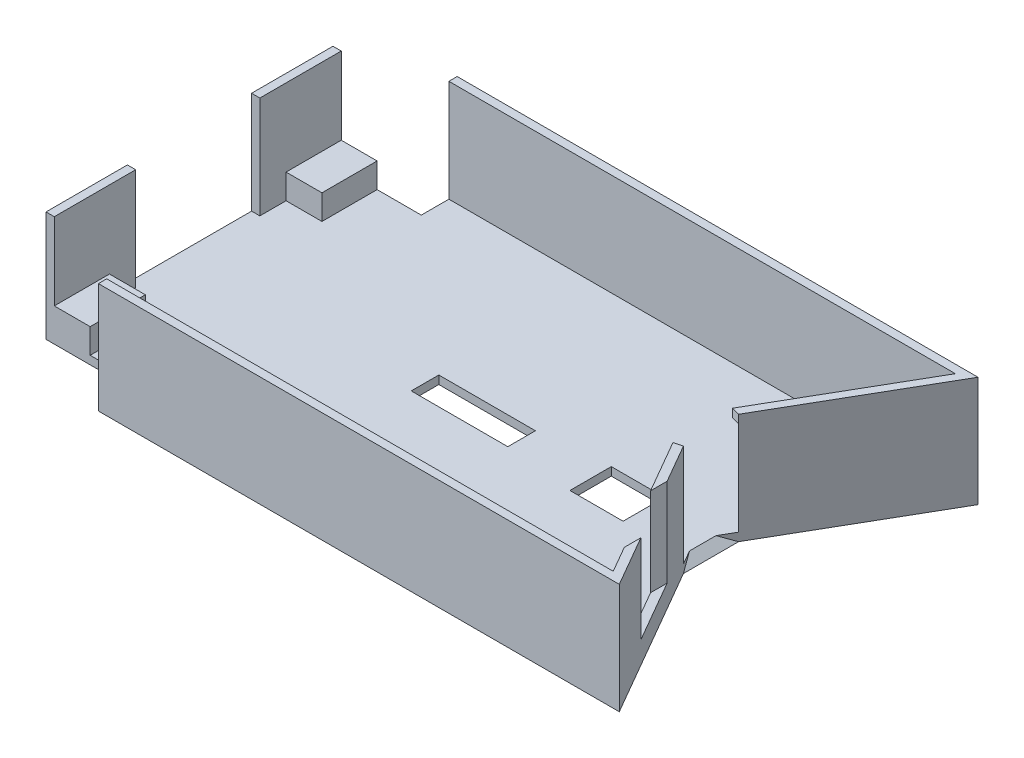
from build123d import *

# Parameters (mm, degrees)
BOSS_EXTRUDE1_DEPTH = 40
SHELL5_START        = 3
SHELL5_DEPTH        = 34
CHAMFER1_SIZE       = 3
CUT_EXTRUDE1_DEPTH  = 3
SKETCH7_W           = 13
SKETCH7_H           = 9
CUT_EXTRUDE3_DEPTH  = 10
SKETCH7_4_W         = 13
SKETCH7_4_H         = 9
BOSS_EXTRUDE7_DEPTH = 30
CUT_EXTRUDE8_DEPTH  = 55
SKETCH7_6_W         = 13
SKETCH7_6_H         = 9
CUT_EXTRUDE10_DEPTH = 10
SKETCH8_W           = 45
SKETCH8_H           = 40
CUT_EXTRUDE4_DEPTH  = 30
SKETCH9_W           = 19.285714286
SKETCH9_H           = 15
SKETCH9_W_2         = 35
SKETCH9_H_2         = 10
CUT_EXTRUDE5_DEPTH  = 30


# Read off the part's stored shape, not the designer's step: Shell5
with BuildPart() as part:
    # Sketch1 → Boss-Extrude1 (new body)
    with BuildSketch(Plane(origin=(0, 0, 0), x_dir=(1, 0, 0), z_dir=(0, 1, 0))):
        Polygon((-90, -65), (130.754264805, -65), (99, -10), (99, 10), (130.754264805, 65), (-90, 65), align=None)
    extrude(amount=BOSS_EXTRUDE1_DEPTH)

    # Shell5 outline → Shell5 (cut)
    with BuildSketch(Plane(origin=(0, 0, 0), x_dir=(1, 0, 0), z_dir=(0, 1, 0)).offset(SHELL5_START)):
        Polygon((99, -16), (99, 16), (125.558112383, 62), (-87, 62), (-87, -62), (125.558112383, -62), align=None)
    extrude(amount=SHELL5_DEPTH, mode=Mode.SUBTRACT)

    # Chamfer1
    chamfer1_edges = [part.edges().sort_by_distance(p)[0] for p in [
        (99, 3, 0),
    ]]
    chamfer(chamfer1_edges, length=CHAMFER1_SIZE - 0.0001)  # a hair under: the kernel refuses the full size

    # Sketch6 → Cut-Extrude1 (cut)
    with BuildSketch(Plane(origin=(0, 40, 0), x_dir=(1, 0, 0), z_dir=(0, 1, 0))):
        Polygon((125.558112383, 62), (-87, 62), (-87, -62), (125.558112383, -62), (96, -10.803847577), (96, 10.803847577), align=None)
        Polygon((99, 10), (96, 10.803847577), (96, -10.803847577), (99, -10), align=None)
    extrude(amount=-CUT_EXTRUDE1_DEPTH, mode=Mode.SUBTRACT)

    # Sketch7 → Cut-Extrude3 (cut)
    with BuildSketch(Plane(origin=(0, 0, 62), x_dir=(-1, 0, 0), z_dir=(0, 0, -1))):
        Polygon((58, 3), (58, -4.5), (103, -4.5), (103, 40.5), (58, 40.5), (58, 40), (87, 40), (87, 12), (87, 3), (74, 3), align=None)
        Polygon((58, 40), (58, 3), (74, 3), (74, 12), (87, 12), (87, 40), align=None)
        with Locations((80.5, 7.5)):
            Rectangle(SKETCH7_W, SKETCH7_H)
    cut_extrude3 = extrude(amount=-CUT_EXTRUDE3_DEPTH, mode=Mode.SUBTRACT)

    # Sketch7<4> → Boss-Extrude7 (add)
    with BuildSketch(Plane(origin=(0, 0, 62), x_dir=(-1, 0, 0), z_dir=(0, 0, -1))):
        with Locations((80.5, 7.5)):
            Rectangle(SKETCH7_4_W, SKETCH7_4_H)
    boss_extrude7 = extrude(amount=BOSS_EXTRUDE7_DEPTH)

    # Sketch12 → Cut-Extrude8 (cut)
    with BuildSketch(Plane(origin=(0, 0, 62), x_dir=(-1, 0, 0), z_dir=(0, 0, -1))):
        Polygon((-107.058112383, 43), (-107.058112383, 8), (-120.058112383, 43), align=None)
        Polygon((-120.058112383, 43), (-120.058112383, 8), (-107.058112383, 8), align=None)
        Polygon((-107.058112383, 40), (-118.943826668, 40), (-107.058112383, 8), align=None)
    extrude(amount=CUT_EXTRUDE8_DEPTH, mode=Mode.SUBTRACT)

    # Sketch7<6> → Cut-Extrude10 (cut)
    with BuildSketch(Plane(origin=(0, 0, 62), x_dir=(-1, 0, 0), z_dir=(0, 0, -1))):
        Polygon((58, 3), (58, -4.5), (103, -4.5), (103, 40.5), (58, 40.5), (58, 40), (87, 40), (87, 12), (87, 3), (74, 3), align=None)
        with Locations((80.5, 7.5)):
            Rectangle(SKETCH7_6_W, SKETCH7_6_H)
        Polygon((58, 40), (58, 3), (74, 3), (74, 12), (87, 12), (87, 40), align=None)
    cut_extrude10 = extrude(amount=CUT_EXTRUDE10_DEPTH, mode=Mode.SUBTRACT)

    # Mirror6: Cut-Extrude3, Boss-Extrude7, Cut-Extrude10 across plane
    add(cut_extrude3.mirror(Plane.XY), mode=Mode.SUBTRACT)
    add(boss_extrude7.mirror(Plane.XY))
    add(cut_extrude10.mirror(Plane.XY), mode=Mode.SUBTRACT)

    # Sketch8 → Cut-Extrude4 (cut)
    with BuildSketch(Plane(origin=(-87, 0, 0), x_dir=(0, 0, -1), z_dir=(1, 0, 0))):
        with Locations((0, 23)):
            Rectangle(SKETCH8_W, SKETCH8_H)
    extrude(amount=-CUT_EXTRUDE4_DEPTH, mode=Mode.SUBTRACT)

    # Sketch9 → Cut-Extrude5 (cut)
    with BuildSketch(Plane(origin=(0, 3, 0), x_dir=(1, 0, 0), z_dir=(0, 1, 0))):
        with Locations((65, 0)):
            Rectangle(SKETCH9_W, SKETCH9_H)
        with Locations((12.857142857, 0)):
            Rectangle(SKETCH9_W_2, SKETCH9_H_2)
    extrude(amount=-CUT_EXTRUDE5_DEPTH, mode=Mode.SUBTRACT)


solid = part.part
